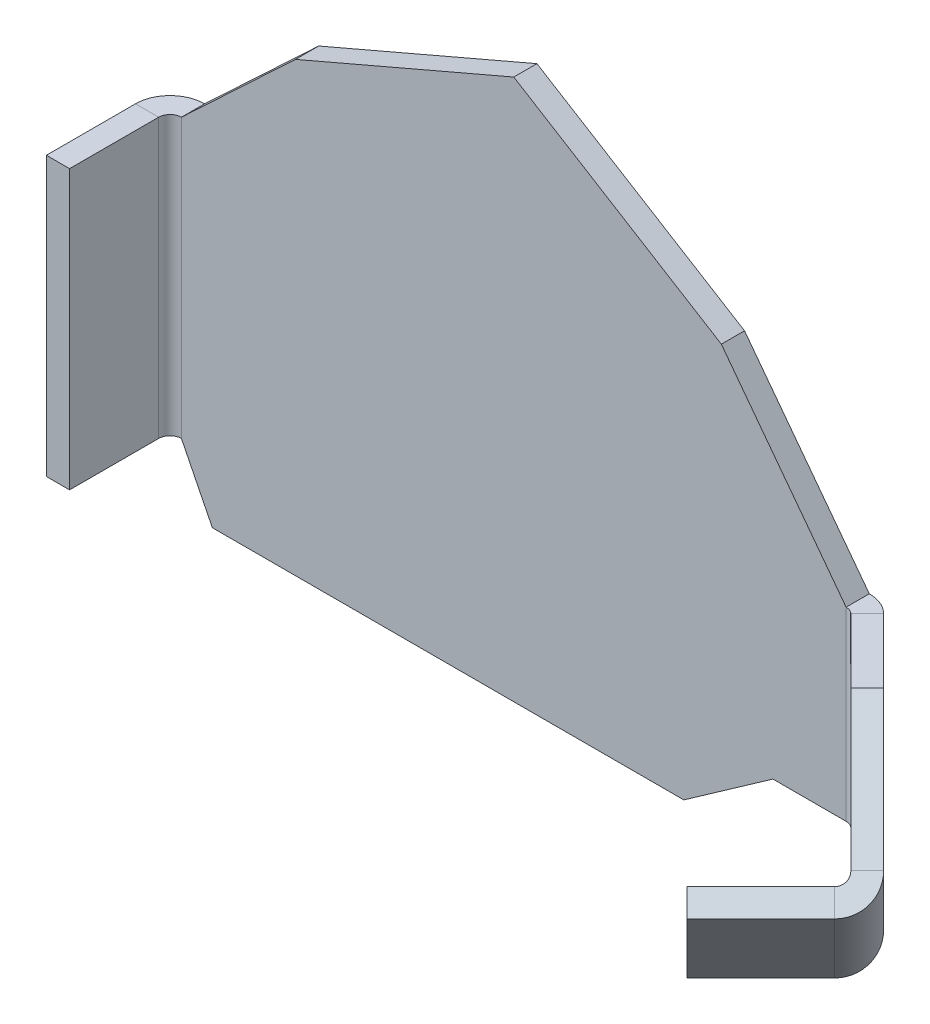
from build123d import *

# Parameters (mm, degrees)
CROQUIS1_W              = 43
CROQUIS1_H              = 35
BRIDA_BASE1_DEPTH       = 1.5
CROQUIS6_W              = 59.566817112
CROQUIS6_H              = 45.88022185
CORTAR_EXTRUIR1_DEPTH   = 10
BRIDA_DE_ARISTA1_DEPTH  = 18
BRIDA_DE_ARISTA2_DEPTH  = 12
CORTAR_EXTRUIR2_DEPTH   = 10
SALIENTE_EXTRUIR1_DEPTH = 1.5
CORTAR_EXTRUIR3_DEPTH   = 10
BRIDA_DE_ARISTA3_DEPTH  = 15.985281374


# Sheet-metal steps are written as plain solids
with BuildPart() as part:
    # Croquis1 → Brida base1 (new body)
    with BuildSketch(Plane.XY):
        Rectangle(CROQUIS1_W, CROQUIS1_H)
    extrude(amount=-BRIDA_BASE1_DEPTH)

    # Croquis6 → Cortar-Extruir1 (cut)
    with BuildSketch(Plane.XY):
        Rectangle(CROQUIS6_W, CROQUIS6_H)
        Polygon((11, -17.5), (16.764888282, -13.45), (21.5, -13.45), (21.5, -1.45), (13.429731846, 9.247432799), (0, 17.5), (-14.121485549, 11.428046656), (-21.5, 4.5), (-21.5, -13.5), (-19.5, -17.5), align=None, mode=Mode.SUBTRACT)
    extrude(amount=-CORTAR_EXTRUIR1_DEPTH, mode=Mode.SUBTRACT)

    # Brida de arista1 section (across the edge) → Brida de arista1 (add)
    with BuildSketch(Plane(origin=(-22.2366, 4.5, 0), x_dir=(1, 0, 0), z_dir=(0, -1, 0))):
        with BuildLine():
            Line((-1.5, 0.7366), (-1.5, 6.5))
            Line((-1.5, 6.5), (0, 6.5))
            Line((0, 6.5), (0, 0.7366))
            ThreePointArc((0, 0.7366), (0.215745145, 0.215745145), (0.7366, 0))
            Line((0.7366, 0), (0.7366, -1.5))
            ThreePointArc((0.7366, -1.5), (-0.844915027, -0.844915027), (-1.5, 0.7366))
        make_face()
    extrude(amount=BRIDA_DE_ARISTA1_DEPTH)

    # Brida de arista2 section (across the edge) → Brida de arista2 (add)
    with BuildSketch(Plane(origin=(21.80510971, -13.45, 0), x_dir=(-0.7071067811865438, 0, 0.7071067811865512), z_dir=(0, 1, 0))):
        with BuildLine():
            Line((-1.5, 0.30510971), (-1.5, 20.378679656))
            Line((-1.5, 20.378679656), (0, 20.378679656))
            Line((0, 20.378679656), (0, 0.30510971))
            ThreePointArc((0, 0.30510971), (0.056070336, 0.023225094), (0.215745145, -0.215745145))
            Line((0.215745145, -0.215745145), (-0.844915027, -1.276405317))
            ThreePointArc((-0.844915027, -1.276405317), (-1.329748962, -0.550800055), (-1.5, 0.30510971))
        make_face()
    extrude(amount=BRIDA_DE_ARISTA2_DEPTH)

    # Croquis13 → Cortar-Extruir2 (cut)
    with BuildSketch(Plane(origin=(11.963215027, 0, -11.963215027), x_dir=(-0.7071067811865513, 0, -0.7071067811865438), z_dir=(0.7071067811865438, 0, -0.7071067811865513))):
        Polygon((-35.797220597, -1.45), (-23.797220597, -13.45), (-35.797220597, -13.45), align=None)
    extrude(amount=-CORTAR_EXTRUIR2_DEPTH, mode=Mode.SUBTRACT)

    # Croquis14 → Saliente-Extruir1 (add)
    with BuildSketch(Plane(origin=(11.963215027, 0, -11.963215027), x_dir=(-0.7071067811865513, 0, -0.7071067811865438), z_dir=(0.7071067811865438, 0, -0.7071067811865513))):
        Polygon((-35.797220597, -1.45), (-23.797220597, -1.45), (-30.161181628, 4.913961031), (-36.161181628, -1.086038969), align=None)
    extrude(amount=-SALIENTE_EXTRUIR1_DEPTH)

    # Croquis15 → Cortar-Extruir3 (cut)
    with BuildSketch(Plane(origin=(10.902554855, 0, -10.902554855), x_dir=(0.7071067811865513, 0, 0.7071067811865438), z_dir=(-0.7071067811865438, 0, 0.7071067811865513))):
        Polygon((30.161181628, 4.913961031), (36.161181628, -1.086038969), (35.100521456, -2.146699141), (29.100521456, 3.853300859), align=None)
    extrude(amount=-CORTAR_EXTRUIR3_DEPTH, mode=Mode.SUBTRACT)

    # Brida de arista3 section (across the edge) → Brida de arista3 (add)
    with BuildSketch(Plane(origin=(28.098030913, -13.970854855, 6.292921202), x_dir=(-0.5000000000000027, 0.7071067811865511, -0.4999999999999924), z_dir=(0.5000000000000054, 0.7071067811865441, 0.49999999999999967))):
        with BuildLine():
            Line((-1.5, 0.7366), (-1.5, 7.5))
            Line((-1.5, 7.5), (0, 7.5))
            Line((0, 7.5), (0, 0.7366))
            ThreePointArc((0, 0.7366), (0.215745145, 0.215745145), (0.7366, 0))
            Line((0.7366, 0), (0.7366, -1.5))
            ThreePointArc((0.7366, -1.5), (-0.844915027, -0.844915027), (-1.5, 0.7366))
        make_face()
    extrude(amount=BRIDA_DE_ARISTA3_DEPTH)


solid = part.part
